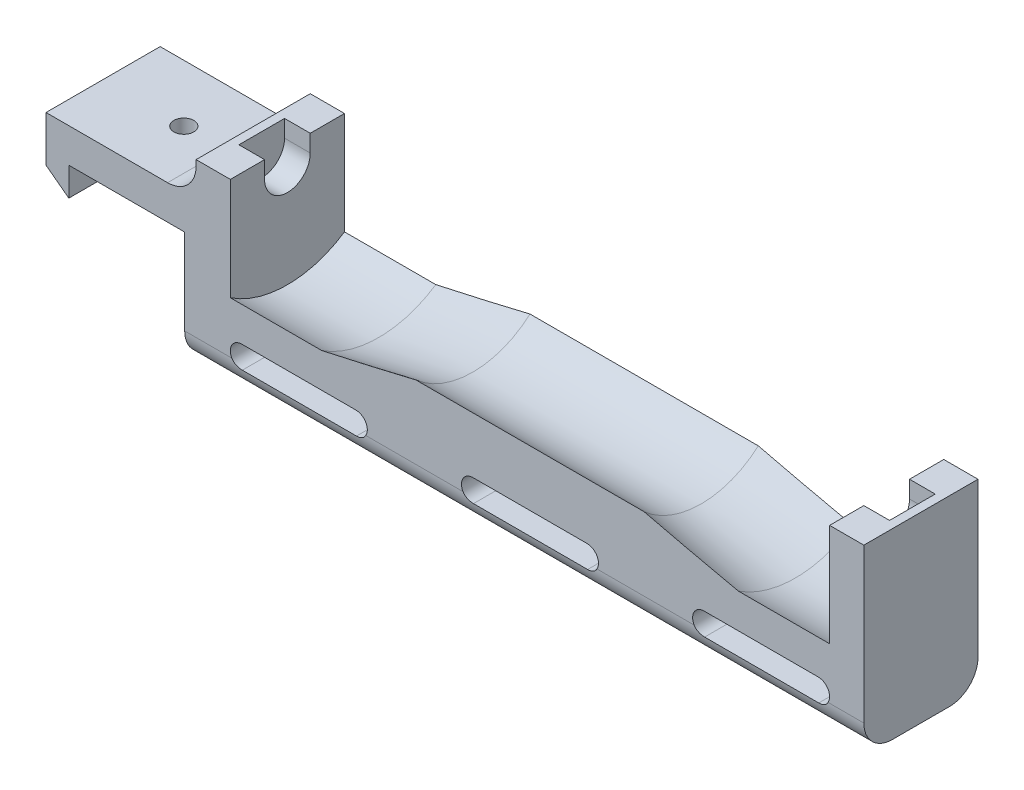
from build123d import *

# Parameters (mm, degrees)
RESSALTO_EXTRUS_O1_DEPTH          = 10
CORTE_EXTRUS_O1_REACH             = 114.894
ESBO_O4_W                         = 8
ESBO_O4_H                         = 3
CORTE_EXTRUS_O1_DIRECTION_2_REACH = 114.894
FILETE1_R                         = 5
ESBO_O7_R                         = 1.75
CORTE_EXTRUS_O3_DEPTH             = 15
FILETE2_R                         = 5


with BuildPart() as part:
    # Esboço1 → Ressalto-extrusão1 (new, symmetric)
    with BuildSketch(Plane.XY):
        Polygon((0, 0), (4, -3), (4, 2), (24.3, 2), (24.3, -18), (143.3, -18), (143.3, 14), (137.3, 14), (137.3, 0), (32.3, 0), (32.3, 14), (26.3, 14), (26.3, 8), (0, 8), align=None)
        with BuildLine():
            Line((34.3, -10), (54.3, -10))
            ThreePointArc((54.3, -10), (56.3, -12), (54.3, -14))
            Line((54.3, -14), (34.3, -14))
            ThreePointArc((34.3, -14), (32.3, -12), (34.3, -10))
        make_face(mode=Mode.SUBTRACT)
        with BuildLine():
            Line((74.8, -10), (94.8, -10))
            ThreePointArc((94.8, -10), (96.8, -12), (94.8, -14))
            Line((94.8, -14), (74.8, -14))
            ThreePointArc((74.8, -14), (72.8, -12), (74.8, -10))
        make_face(mode=Mode.SUBTRACT)
        with BuildLine():
            Line((115.3, -10), (135.3, -10))
            ThreePointArc((135.3, -10), (137.3, -12), (135.3, -14))
            Line((135.3, -14), (115.3, -14))
            ThreePointArc((115.3, -14), (113.3, -12), (115.3, -10))
        make_face(mode=Mode.SUBTRACT)
    extrude(amount=RESSALTO_EXTRUS_O1_DEPTH, both=True)

    # Esboço2 → Corte-Revolução1 (revolve, cut)
    with BuildSketch(Plane.XY):
        Polygon((27.8, 11), (141.8, 11), (141.8, 7), (137.3, 7), (137.3, -7), (121.3, -7), (104.8, -4), (64.8, -4), (48.3, -7), (32.3, -7), (32.3, 7), (27.8, 7), align=None)
    revolve(axis=Axis((27.8, 11, 0), (1, 0, 0)), mode=Mode.SUBTRACT)

    # Corte-extrusão1: up to this face of the body (flat: up to its plane)
    corte_extrus_o1_end = Plane(part.part.faces().sort_by_distance((27.8, 10.735267855, 0))[0])
    # Esboço4 → Corte-extrusão1 (cut, up to the picked face)
    with BuildSketch(Plane(origin=(32.3, 0, 0), x_dir=(0, 0, -1), z_dir=(1, 0, 0)), mode=Mode.PRIVATE) as corte_extrus_o1_sk1:
        with Locations((0, 12.5)):
            Rectangle(ESBO_O4_W, ESBO_O4_H)
    corte_extrus_o1_tool1 = split(extrude(corte_extrus_o1_sk1.sketch, amount=-CORTE_EXTRUS_O1_REACH, mode=Mode.PRIVATE), bisect_by=corte_extrus_o1_end, keep=Keep.BOTH, mode=Mode.PRIVATE)
    add(corte_extrus_o1_tool1.solids().sort_by(Axis((32.3, 12.5, 0), (-1, 0, 0)))[0], mode=Mode.SUBTRACT)

    # Corte-extrusão1 direction 2: up to this face of the body (flat: up to its plane)
    corte_extrus_o1_direction_2_end = Plane(part.part.faces().sort_by_distance((141.8, 10.735267855, 0))[0])
    # Esboço4 → Corte-extrusão1 direction 2 (cut, up to the picked face)
    with BuildSketch(Plane(origin=(32.3, 0, 0), x_dir=(0, 0, -1), z_dir=(1, 0, 0)), mode=Mode.PRIVATE) as corte_extrus_o1_direction_2_sk1:
        with Locations((0, 12.5)):
            Rectangle(ESBO_O4_W, ESBO_O4_H)
    corte_extrus_o1_direction_2_tool1 = split(extrude(corte_extrus_o1_direction_2_sk1.sketch, amount=CORTE_EXTRUS_O1_DIRECTION_2_REACH, mode=Mode.PRIVATE), bisect_by=corte_extrus_o1_direction_2_end, keep=Keep.BOTH, mode=Mode.PRIVATE)
    add(corte_extrus_o1_direction_2_tool1.solids().sort_by(Axis((32.3, 12.5, 0), (1, 0, 0)))[0], mode=Mode.SUBTRACT)

    # Filete1
    # the kernel refuses this fillet: 5 mm, written as the material it takes off along each edge
    with BuildSketch(Plane(origin=(11.8, -18, -10), x_dir=(0, 0, 1), z_dir=(1, 0, 0))) as filete1_piece_1:
        with BuildLine():
            CenterArc((FILETE1_R, -FILETE1_R), FILETE1_R, 90, 90)
            Line((0, -FILETE1_R), (0, 0))
            Line((0, 0), (FILETE1_R, 0))
        make_face()
    extrude(amount=144, mode=Mode.SUBTRACT)
    with BuildSketch(Plane(origin=(11.8, -18, 10), x_dir=(0, 0, -1), z_dir=(1, 0, 0))) as filete1_piece_2:
        with BuildLine():
            CenterArc((FILETE1_R, FILETE1_R), FILETE1_R, 180, 90)
            Line((0, FILETE1_R), (0, 0))
            Line((0, 0), (FILETE1_R, 0))
        make_face()
    extrude(amount=144, mode=Mode.SUBTRACT)

    # Esboço7 → Corte-extrusão3 (cut)
    with BuildSketch(Plane.XZ.offset(-2)):
        with Locations(Location((14.15, 0, 0), (0, 0, 270))):
            Circle(ESBO_O7_R)
    extrude(amount=-CORTE_EXTRUS_O3_DEPTH, mode=Mode.SUBTRACT)

    # Filete2
    filete2_edges = [part.edges().sort_by_distance(p)[0] for p in [
        (26.3, 8, 0),
    ]]
    fillet(filete2_edges, radius=FILETE2_R)


solid = part.part
